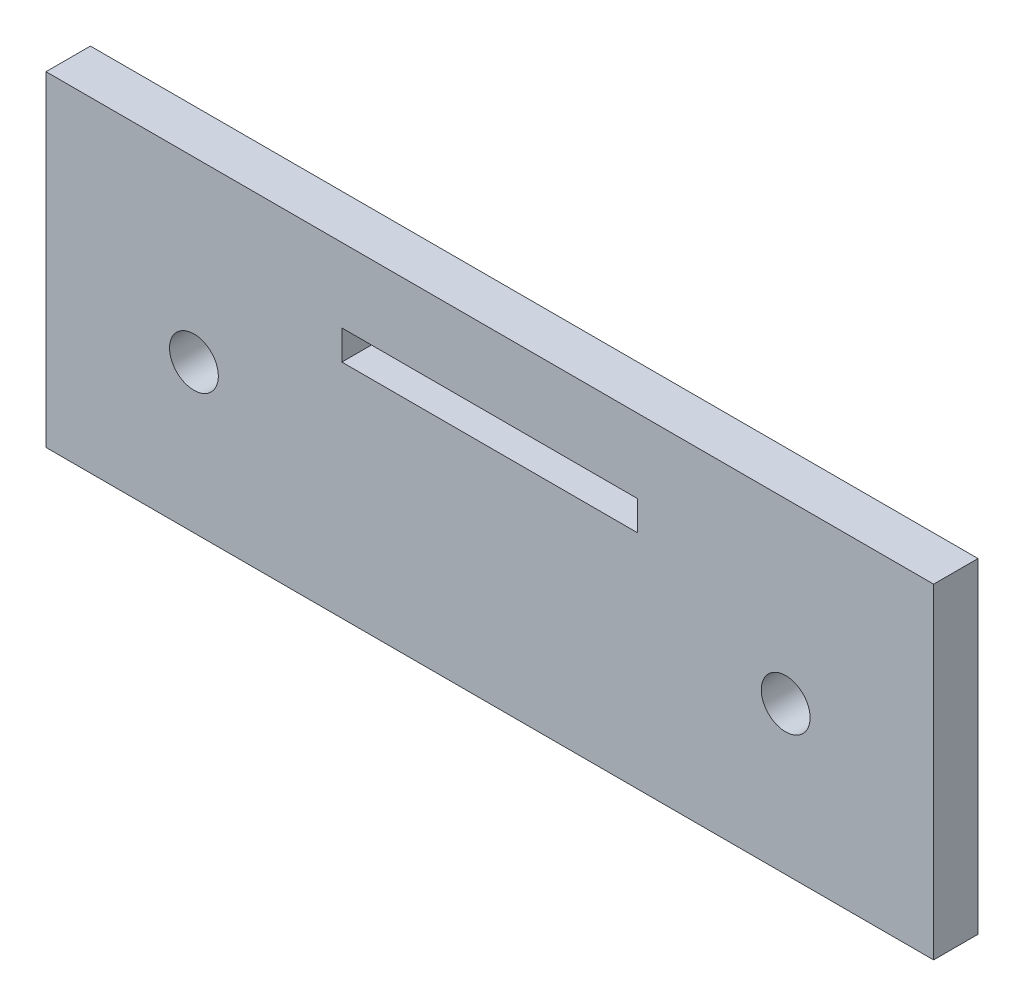
from build123d import *

# Parameters (mm, degrees)
SKETCH_2_W             = 60
SKETCH_2_H             = 22
SM_BASE_FLANGE_1_DEPTH = 3
SKETCH_7_W             = 20
SKETCH_7_H             = 2
CUT_EXTRUDE_1_DEPTH    = 30
SKETCH_8_R             = 1.65
CUT_EXTRUDE_2_DEPTH    = 10


# Sheet-metal steps are written as plain solids
with BuildPart() as part:
    # Sketch 2 → 基体-法兰1 (new body)
    with BuildSketch(Plane.XY):
        with Locations((30, 11)):
            Rectangle(SKETCH_2_W, SKETCH_2_H)
    extrude(amount=-SM_BASE_FLANGE_1_DEPTH)

    # 草图7 → 切除-拉伸1 (cut)
    with BuildSketch(Plane.XY):
        with Locations((30, 16)):
            Rectangle(SKETCH_7_W, SKETCH_7_H)
    extrude(amount=-CUT_EXTRUDE_1_DEPTH, mode=Mode.SUBTRACT)

    # 草图8 → 切除-拉伸2 (cut)
    with BuildSketch(Plane.XY):
        with Locations((10, 10)):
            Circle(SKETCH_8_R)
        with Locations((50, 10)):
            Circle(SKETCH_8_R)
    extrude(amount=-CUT_EXTRUDE_2_DEPTH, mode=Mode.SUBTRACT)


solid = part.part
